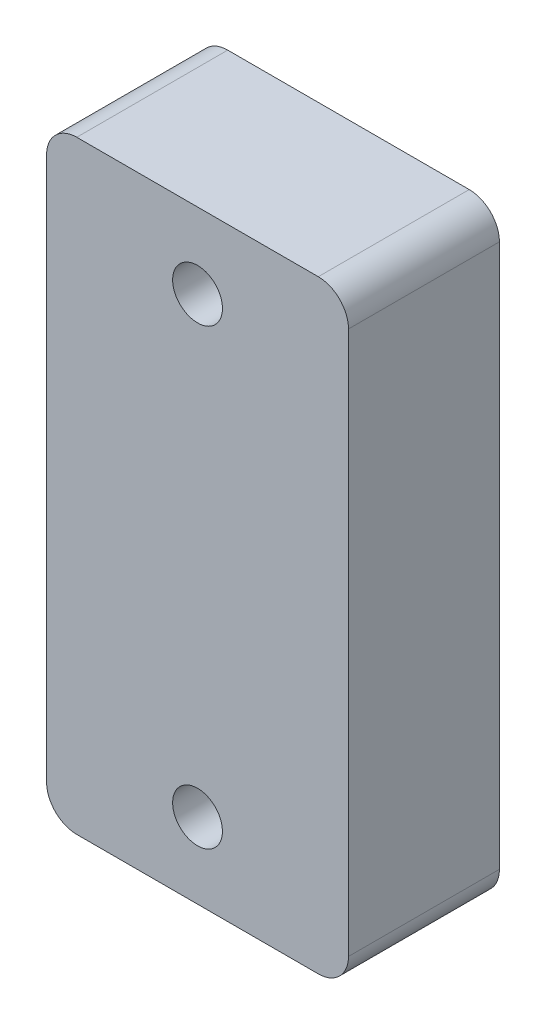
from build123d import *

# Parameters (mm, degrees)
SKETCH_1_W      = 20
SKETCH_1_H      = 40
SKETCH_1_R      = 1.65
EXTRUDE_1_DEPTH = 10
FILLET_1_R      = 2


with BuildPart() as part:
    # 草图1 → 凸台-拉伸1 (new body)
    with BuildSketch(Plane.XY):
        Rectangle(SKETCH_1_W, SKETCH_1_H)
        with Locations((0, 15)):
            Circle(SKETCH_1_R, mode=Mode.SUBTRACT)
        with Locations((0, -15)):
            Circle(SKETCH_1_R, mode=Mode.SUBTRACT)
    extrude(amount=EXTRUDE_1_DEPTH)

    # 圆角1
    fillet_1_edges = [part.edges().sort_by_distance(p)[0] for p in [
        (10, -20, 5),
        (-10, -20, 5),
        (-10, 20, 5),
        (10, 20, 5),
    ]]
    fillet(fillet_1_edges, radius=FILLET_1_R)


solid = part.part
